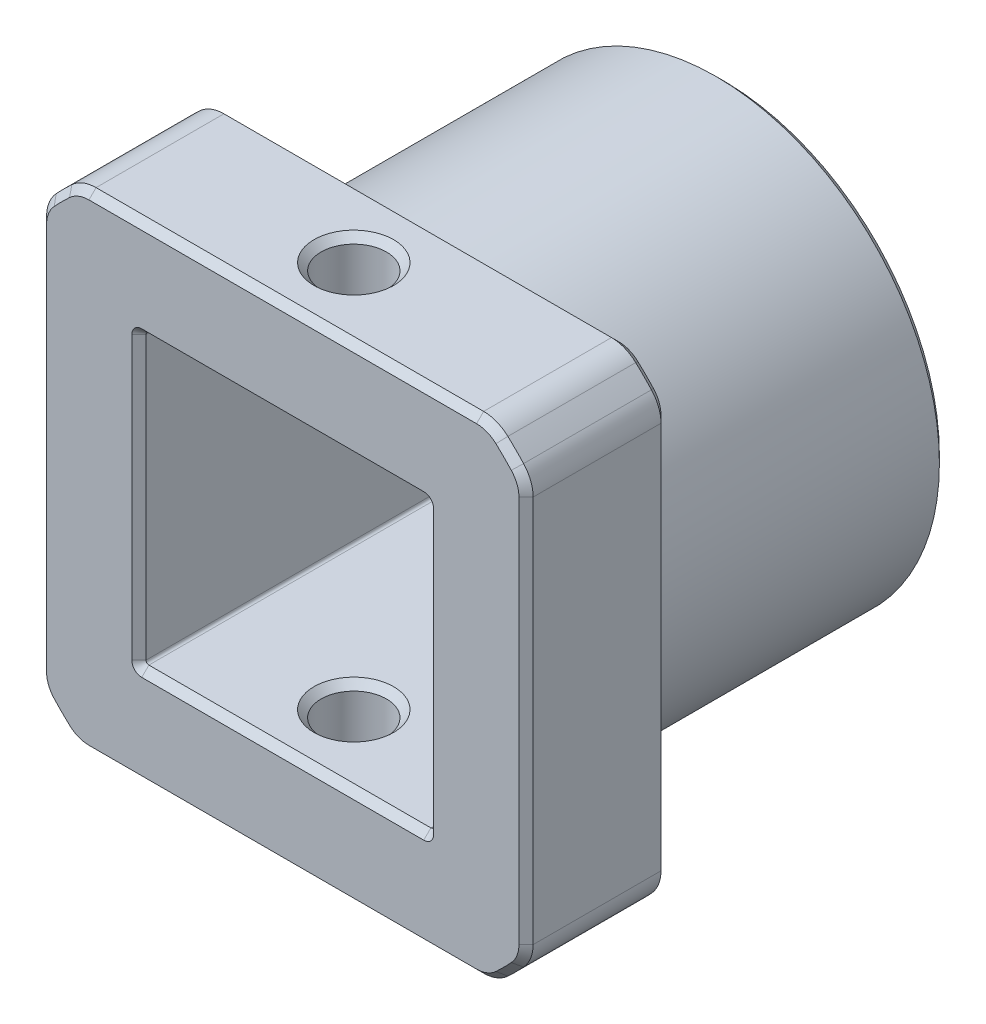
from build123d import *

# Parameters (mm, degrees)
SKIZZE1_R                       = 15.725
SKIZZE1_W                       = 20.25
SKIZZE1_H                       = 20.25
AUFSATZ_LINEAR_AUSTRAGEN1_DEPTH = 21
SKIZZE2_W                       = 20.25
SKIZZE2_H                       = 20.25
AUFSATZ_LINEAR_AUSTRAGEN2_DEPTH = 10
SKIZZE3_R                       = 2.3
SCHNITT_LINEAR_AUSTRAGEN1_DEPTH = 50.267921866
VERRUNDUNG1_R                   = 0.2
VERRUNDUNG2_R                   = 2.5
FASE1_SIZE                      = 0.5
FASE4_SIZE                      = 0.5


with BuildPart() as part:
    # Skizze1 → Aufsatz-Linear austragen1 (new body)
    with BuildSketch(Plane.XY):
        Circle(SKIZZE1_R)
        Rectangle(SKIZZE1_W, SKIZZE1_H, mode=Mode.SUBTRACT)
    extrude(amount=AUFSATZ_LINEAR_AUSTRAGEN1_DEPTH)

    # Skizze2 → Aufsatz-Linear austragen2 (add)
    with BuildSketch(Plane.XY.offset(21)):
        with BuildLine():
            Line((-14.593984206, 17.125), (14.593984206, 17.125))
            ThreePointArc((14.593984206, 17.125), (15.909902577, 15.909902577), (17.125, 14.593984206))
            Line((17.125, 14.593984206), (17.125, -14.593984206))
            ThreePointArc((17.125, -14.593984206), (15.909902577, -15.909902577), (14.593984206, -17.125))
            Line((14.593984206, -17.125), (-14.593984206, -17.125))
            ThreePointArc((-14.593984206, -17.125), (-15.909902577, -15.909902577), (-17.125, -14.593984206))
            Line((-17.125, -14.593984206), (-17.125, 14.593984206))
            ThreePointArc((-17.125, 14.593984206), (-15.909902577, 15.909902577), (-14.593984206, 17.125))
        make_face()
        Rectangle(SKIZZE2_W, SKIZZE2_H, mode=Mode.SUBTRACT)
    extrude(amount=AUFSATZ_LINEAR_AUSTRAGEN2_DEPTH)

    # Skizze3 → Schnitt-Linear austragen1 (cut, through all)
    with BuildSketch(Plane(origin=(0, 17.125, 0), x_dir=(1, 0, 0), z_dir=(0, 1, 0))):
        with Locations((0, -26)):
            Circle(SKIZZE3_R)
    extrude(amount=-SCHNITT_LINEAR_AUSTRAGEN1_DEPTH, mode=Mode.SUBTRACT)

    # Verrundung1
    verrundung1_edges = [part.edges().sort_by_distance(p)[0] for p in [
        (10.125, -10.125, 15.5),
        (-10.125, -10.125, 15.5),
        (-10.125, 10.125, 15.5),
        (10.125, 10.125, 15.5),
    ]]
    fillet(verrundung1_edges, radius=VERRUNDUNG1_R)

    # Verrundung2
    verrundung2_edges = [part.edges().sort_by_distance(p)[0] for p in [
        (-17.125, -14.593984206, 26),
        (-14.593984206, -17.125, 26),
        (14.593984206, -17.125, 26),
        (17.125, -14.593984206, 26),
        (17.125, 14.593984206, 26),
        (14.593984206, 17.125, 26),
        (-17.125, 14.593984206, 26),
        (-14.593984206, 17.125, 26),
    ]]
    fillet(verrundung2_edges, radius=VERRUNDUNG2_R)

    # Fase1
    fase1_edges = [part.edges().sort_by_distance(p)[0] for p in [
        (-10.066421356, -10.066421356, 0),
        (-10.125, 0, 0),
        (-10.066421356, 10.066421356, 0),
        (0, 10.125, 0),
        (10.066421356, 10.066421356, 0),
        (10.125, 0, 0),
        (10.066421356, -10.066421356, 0),
        (0, -10.125, 0),
        (-15.725, 0, 0),
        (-10.066421356, 10.066421356, 31),
        (-10.125, 0, 31),
        (-10.066421356, -10.066421356, 31),
        (0, -10.125, 31),
        (10.066421356, -10.066421356, 31),
        (10.125, 0, 31),
        (10.066421356, 10.066421356, 31),
        (0, 10.125, 31),
        (-16.950974258, 14.558620883, 31),
        (-15.909902577, 15.909902577, 31),
        (-14.558620883, 16.950974258, 31),
        (0, 17.125, 31),
        (14.558620883, 16.950974258, 31),
        (15.909902577, 15.909902577, 31),
        (16.950974258, 14.558620883, 31),
        (17.125, 0, 31),
        (16.950974258, -14.558620883, 31),
        (15.909902577, -15.909902577, 31),
        (14.558620883, -16.950974258, 31),
        (0, -17.125, 31),
        (-14.558620883, -16.950974258, 31),
        (-15.909902577, -15.909902577, 31),
        (-16.950974258, -14.558620883, 31),
        (-17.125, 0, 31),
        (-2.3, -10.125, 26),
        (-2.3, 10.125, 26),
        (-2.3, -17.125, 26),
        (-2.3, 17.125, 26),
    ]]
    chamfer(fase1_edges, length=FASE1_SIZE)

    # Fase4
    fase4_edges = [part.edges().sort_by_distance(p)[0] for p in [
        (0, -17.125, 21),
        (14.558620883, -16.950974258, 21),
        (-14.558620883, -16.950974258, 21),
        (15.909902577, -15.909902577, 21),
        (-15.909902577, -15.909902577, 21),
        (16.950974258, -14.558620883, 21),
        (-16.950974258, -14.558620883, 21),
        (17.125, 0, 21),
        (-17.125, 0, 21),
        (16.950974258, 14.558620883, 21),
        (-16.950974258, 14.558620883, 21),
        (15.909902577, 15.909902577, 21),
        (-15.909902577, 15.909902577, 21),
        (14.558620883, 16.950974258, 21),
        (-14.558620883, 16.950974258, 21),
        (0, 17.125, 21),
    ]]
    chamfer(fase4_edges, length=FASE4_SIZE)


solid = part.part
